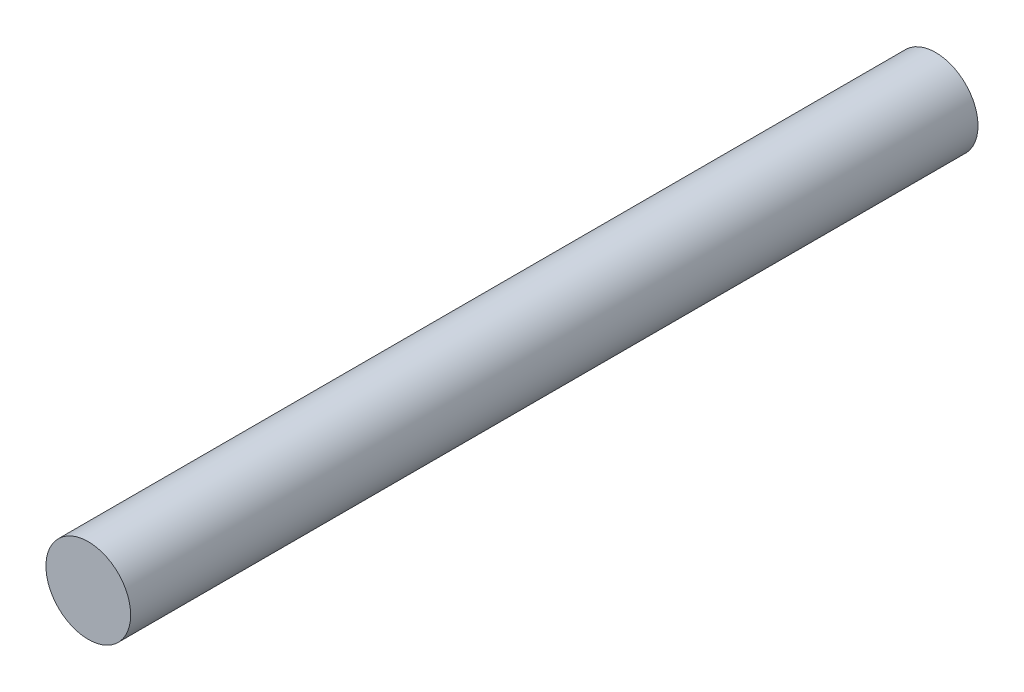
from build123d import *

# Parameters (mm, degrees)
SKETCH1_R           = 12.7
BOSS_EXTRUDE1_DEPTH = 127


with BuildPart() as part:
    # Sketch1 → Boss-Extrude1 (new, symmetric)
    with BuildSketch(Plane.XY):
        Circle(SKETCH1_R)
    extrude(amount=BOSS_EXTRUDE1_DEPTH, both=True)


solid = part.part
